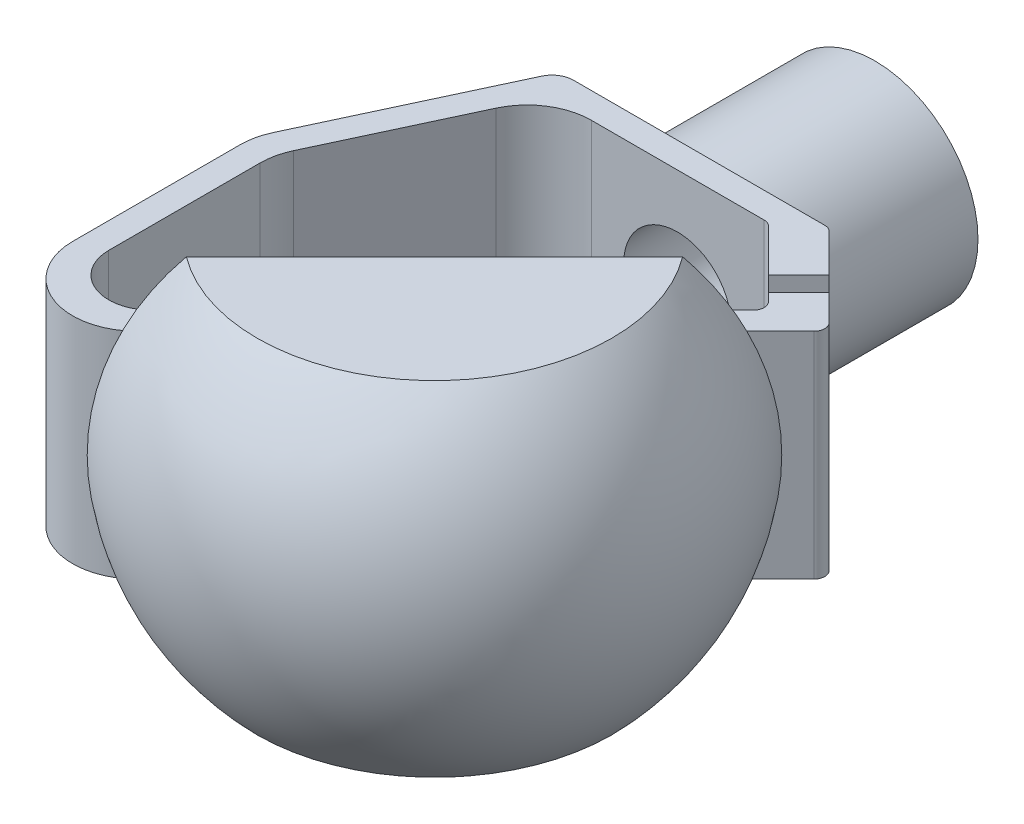
from build123d import *

# Parameters (mm, degrees)
SKETCH16_W           = 2.4
SKETCH16_H           = 4
BOSS_EXTRUDE11_DEPTH = 2.5
SKETCH19_R           = 1.25
CUT_EXTRUDE12_DEPTH  = 5
CUT_EXTRUDE13_DEPTH  = 10


with BuildPart() as part:
    # Sketch16 → Revolve1 (revolve)
    with BuildSketch(Plane(origin=(0, 0, 0), x_dir=(1, 0, 0), z_dir=(0, 1, 0))):
        with Locations((-1.2, -2)):
            Rectangle(SKETCH16_W, SKETCH16_H)
    revolve(axis=Axis((0, 0, -4.094545455), (0, 0, 1)))

    # Sketch18 → Boss-Extrude11 (add, symmetric)
    with BuildSketch(Plane(origin=(0, 0, 0), x_dir=(1, 0, 0), z_dir=(0, 1, 0))):
        with BuildLine():
            Line((0, -4), (-3.019312417, -4))
            ThreePointArc((-3.019312417, -4), (-3.287962221, -4.078304277), (-3.472466311, -4.288690869))
            Line((-3.472466311, -4.288690869), (-5.459461681, -8.549816191))
            ThreePointArc((-5.459461681, -8.549816191), (-5.564444011, -8.859084162), (-5.6, -9.183743583))
            Line((-5.6, -9.183743583), (-5.6, -13.084062043))
            ThreePointArc((-5.6, -13.084062043), (-4.674025149, -14.469881342), (-3.039339828, -14.144722215))
            Line((-3.039339828, -14.144722215), (4.843681451, -6.261700936))
            ThreePointArc((4.843681451, -6.261700936), (4.916904756, -6.08492424), (4.843681451, -5.908147545))
            Line((4.843681451, -5.908147545), (4.242640687, -5.307106781))
            Line((4.242640687, -5.307106781), (3.535533906, -6.014213562))
            Line((3.535533906, -6.014213562), (3.712310601, -6.190990258))
            ThreePointArc((3.712310601, -6.190990258), (3.785533906, -6.367766953), (3.712310601, -6.544543648))
            Line((3.712310601, -6.544543648), (-3.292893219, -13.549747468))
            ThreePointArc((-3.292893219, -13.549747468), (-4.382683432, -13.76652022), (-5, -12.842640687))
            Line((-5, -12.842640687), (-5, -9.316760381))
            ThreePointArc((-5, -9.316760381), (-4.964444011, -8.99210096), (-4.859461681, -8.682832988))
            Line((-4.859461681, -8.682832988), (-3.359461681, -5.466072607))
            ThreePointArc((-3.359461681, -5.466072607), (-2.805949413, -4.834912831), (-2, -4.6))
            Line((-2, -4.6), (0, -4.6))
            Line((0, -4.6), (2.017766953, -4.6))
            ThreePointArc((2.017766953, -4.6), (2.113437811, -4.619030117), (2.194543648, -4.673223305))
            Line((2.194543648, -4.673223305), (3.181980515, -5.660660172))
            Line((3.181980515, -5.660660172), (3.889087297, -4.953553391))
            Line((3.889087297, -4.953553391), (3.008757211, -4.073223305))
            ThreePointArc((3.008757211, -4.073223305), (2.927651373, -4.019030117), (2.831980515, -4))
            Line((2.831980515, -4), (0, -4))
        make_face()
    extrude(amount=BOSS_EXTRUDE11_DEPTH, both=True)

    # Sketch19 → Cut-Extrude12 (cut)
    with BuildSketch(Plane(origin=(0, 0, 0), x_dir=(-1, 0, 0), z_dir=(0, 0, -1))):
        Circle(SKETCH19_R)
    extrude(amount=-CUT_EXTRUDE12_DEPTH, mode=Mode.SUBTRACT)

    # Sketch22 → Revolve2 (revolve)
    with BuildSketch(Plane.XZ):
        with BuildLine():
            Line((0.424264069, 10.681118318), (-3.619403821, 14.724786208))
            ThreePointArc((-3.619403821, 14.724786208), (0.300410275, 15.99900138), (4.065863992, 14.322718241))
            Line((4.065863992, 14.322718241), (0.424264069, 10.681118318))
        make_face()
    revolve(axis=Axis((0, 0, 10.256854249), (0.7071067811865477, 0, 0.7071067811865474)))

    # Sketch23 → Cut-Extrude13 (cut)
    with BuildSketch(Plane(origin=(5.552691193, 0, 5.552691193), x_dir=(-0.7071067811865476, 0, 0.7071067811865476), z_dir=(-0.7071067811865476, 0, -0.7071067811865476))):
        with BuildLine():
            Line((11.339560411, 4), (3.165821976, 4))
            ThreePointArc((3.165821976, 4), (7.252691193, 5.718609971), (11.339560411, 4))
        make_face()
        with BuildLine():
            Line((11.339560411, -4), (3.165821976, -4))
            ThreePointArc((3.165821976, -4), (7.252691193, -5.718609971), (11.339560411, -4))
        make_face()
    extrude(amount=-CUT_EXTRUDE13_DEPTH, mode=Mode.SUBTRACT)


solid = part.part
